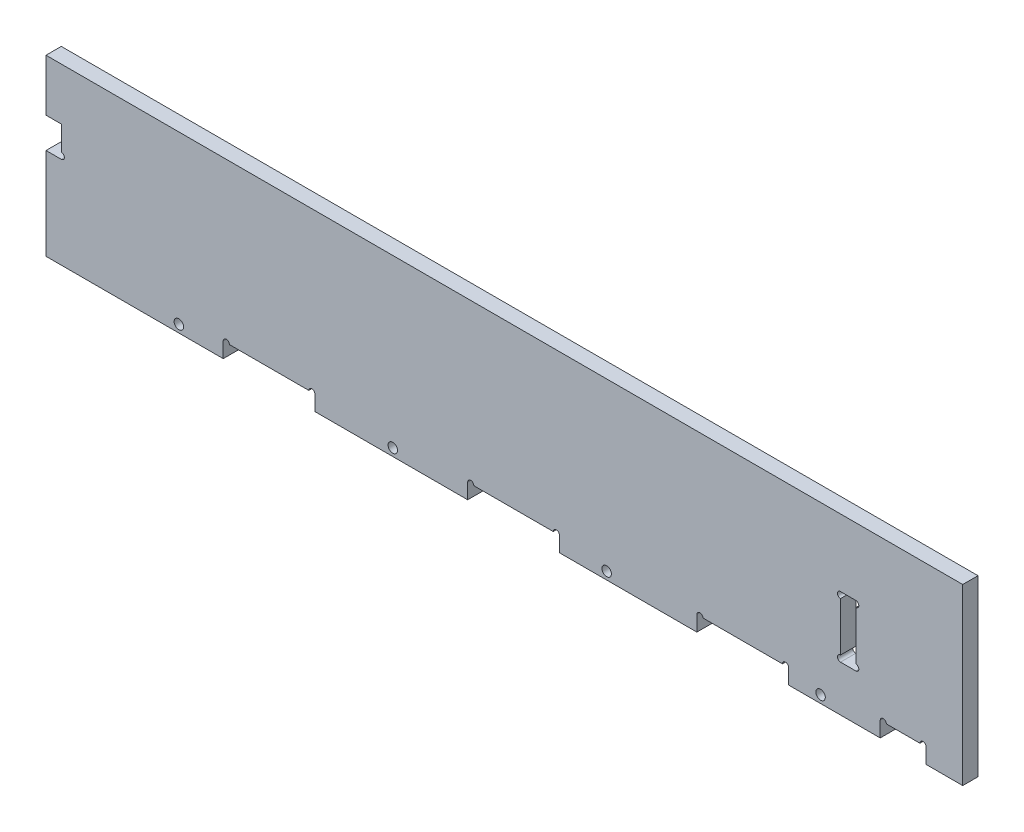
from build123d import *

# Parameters (mm, degrees)
SKETCH_1_W          = 300
SKETCH_1_H          = 57
EXTRUDE_1_DEPTH     = 5
SKETCH_2_W          = 5
SKETCH_2_H          = 10
SKETCH_2_W_2        = 30
SKETCH_2_H_2        = 5
SKETCH_2_W_3        = 15
SKETCH_2_H_3        = 20
CUT_EXTRUDE_1_DEPTH = 5
SKETCH_3_R          = 1
CUT_EXTRUDE_2_DEPTH = 5
SKETCH_4_R          = 1.55
CUT_EXTRUDE_3_DEPTH = 10


with BuildPart() as part:
    # 스케치1 → 보스-돌출1 (new body)
    with BuildSketch(Plane.XY):
        with Locations((150, 28.5)):
            Rectangle(SKETCH_1_W, SKETCH_1_H)
    extrude(amount=EXTRUDE_1_DEPTH)

    # 스케치2 → 컷-돌출1 (cut)
    with BuildSketch(Plane.XY.offset(5)):
        with Locations((2.5, 35)):
            Rectangle(SKETCH_2_W, SKETCH_2_H)
        with Locations((73, 2.5)):
            Rectangle(SKETCH_2_W_2, SKETCH_2_H_2)
        with Locations((153, 2.5)):
            Rectangle(SKETCH_2_W_2, SKETCH_2_H_2)
        with Locations((228, 2.5)):
            Rectangle(SKETCH_2_W_2, SKETCH_2_H_2)
        with Locations((280.5, 2.5)):
            Rectangle(SKETCH_2_W_3, SKETCH_2_H_2)
        with Locations((262.5, 25)):
            Rectangle(SKETCH_2_W, SKETCH_2_H_3)
    extrude(amount=-CUT_EXTRUDE_1_DEPTH, mode=Mode.SUBTRACT)

    # 스케치3 → 컷-돌출2 (cut)
    with BuildSketch(Plane.XY.offset(5)):
        with Locations((274, 5)):
            Circle(SKETCH_3_R)
        with Locations((287, 5)):
            Circle(SKETCH_3_R)
        with Locations((260, 16)):
            Circle(SKETCH_3_R)
        with Locations((265, 16)):
            Circle(SKETCH_3_R)
        with Locations((265, 34)):
            Circle(SKETCH_3_R)
        with Locations((260, 34)):
            Circle(SKETCH_3_R)
        with Locations((214, 5)):
            Circle(SKETCH_3_R)
        with Locations((242, 5)):
            Circle(SKETCH_3_R)
        with Locations((87, 5)):
            Circle(SKETCH_3_R)
        with Locations((139, 5)):
            Circle(SKETCH_3_R)
        with Locations((167, 5)):
            Circle(SKETCH_3_R)
        with Locations((5, 31)):
            Circle(SKETCH_3_R)
        with Locations((59, 5)):
            Circle(SKETCH_3_R)
    extrude(amount=-CUT_EXTRUDE_2_DEPTH, mode=Mode.SUBTRACT)

    # 스케치4 → 컷-돌출3 (cut)
    with BuildSketch(Plane(origin=(0, 0, 0), x_dir=(-1, 0, 0), z_dir=(0, 0, -1))):
        with Locations((-253.478741621, 2.5)):
            Circle(SKETCH_4_R)
        with Locations((-183.478741621, 2.5)):
            Circle(SKETCH_4_R)
        with Locations((-113.478741621, 2.5)):
            Circle(SKETCH_4_R)
        with Locations((-43.478741621, 2.5)):
            Circle(SKETCH_4_R)
    extrude(amount=-CUT_EXTRUDE_3_DEPTH, mode=Mode.SUBTRACT)


solid = part.part
